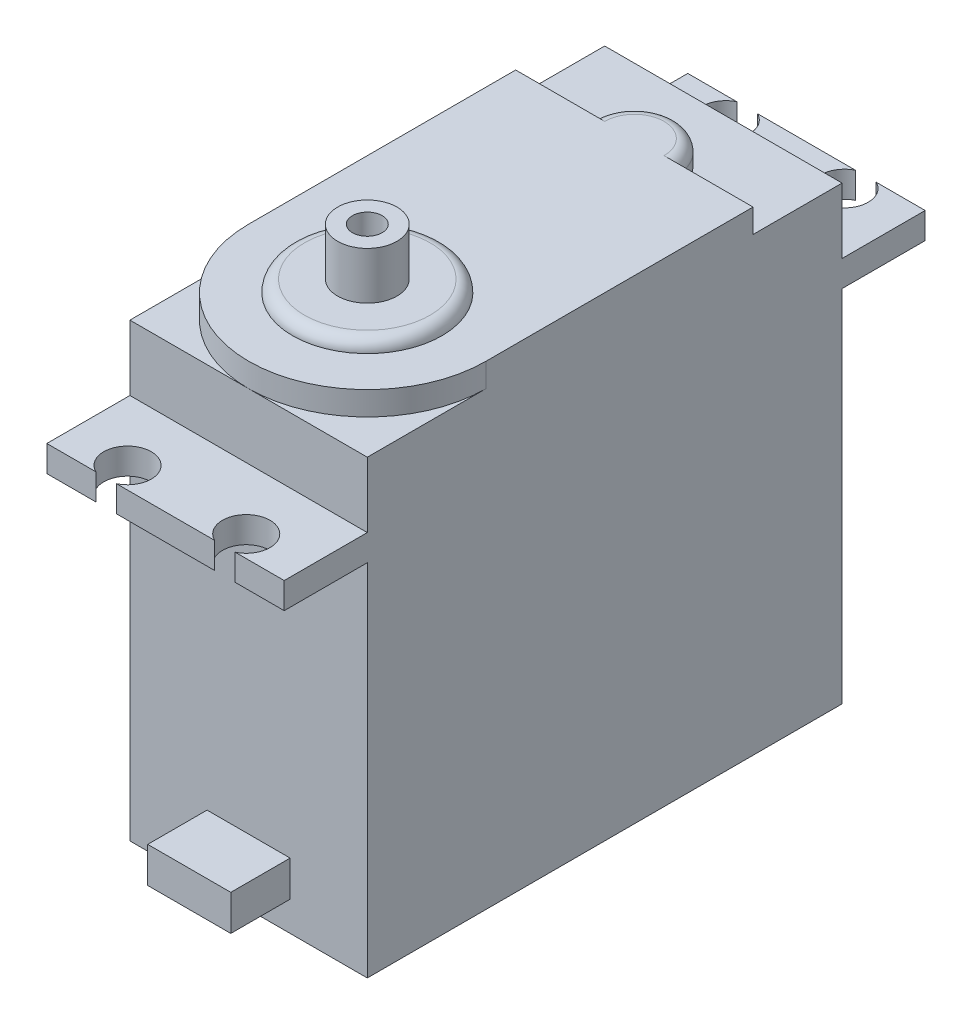
from build123d import *

# Parameters (mm, degrees)
SKETCH1_W                = 20
SKETCH1_H                = 40
BOSS_EXTRUDE1_DEPTH      = 38
SKETCH2_W                = 7
SKETCH2_H                = 3
BOSS_EXTRUDE2_DEPTH      = 5
SKETCH3_R                = 2.5
BOSS_EXTRUDE3_DEPTH      = 7
BOSS_EXTRUDE4_DEPTH      = 7
BOSS_EXTRUDE4_DEPTH_BACK = 47
SKETCH4_W                = 20
SKETCH4_H                = 2.2
SKETCH5_R                = 2
CUT_EXTRUDE1_DEPTH       = 7
BOSS_EXTRUDE5_DEPTH      = 2
SKETCH7_R                = 6.289454611
BOSS_EXTRUDE6_DEPTH      = 1
FILLET1_R                = 1
FILLET2_R                = 1
SKETCH8_R                = 1.25
CUT_EXTRUDE2_DEPTH       = 5


with BuildPart() as part:
    # Sketch1 → Boss-Extrude1 (new body)
    with BuildSketch(Plane(origin=(0, 0, 0), x_dir=(1, 0, 0), z_dir=(0, 1, 0))):
        with Locations((10, 20)):
            Rectangle(SKETCH1_W, SKETCH1_H)
    extrude(amount=BOSS_EXTRUDE1_DEPTH)

    # Sketch2 → Boss-Extrude2 (add)
    with BuildSketch(Plane.XY):
        with Locations((10, 4)):
            Rectangle(SKETCH2_W, SKETCH2_H)
    extrude(amount=BOSS_EXTRUDE2_DEPTH)

    # Sketch3 → Boss-Extrude3 (add)
    with BuildSketch(Plane(origin=(0, 38, 0), x_dir=(1, 0, 0), z_dir=(0, 1, 0))):
        with Locations(Location((10, 10, 0), (0, 0, 90))):
            Circle(SKETCH3_R)
    extrude(amount=BOSS_EXTRUDE3_DEPTH)

    # Sketch4 → Boss-Extrude4 (add, two sides: drawn at the far end of the back side and taken through both)
    with BuildSketch(Plane.XY.offset(-BOSS_EXTRUDE4_DEPTH_BACK)):
        with Locations((10, 31.4)):
            Rectangle(SKETCH4_W, SKETCH4_H)
    extrude(amount=BOSS_EXTRUDE4_DEPTH + BOSS_EXTRUDE4_DEPTH_BACK)

    # Sketch5 → Cut-Extrude1 (cut)
    with BuildSketch(Plane(origin=(0, 32.5, 0), x_dir=(1, 0, 0), z_dir=(0, 1, 0))):
        with Locations((15, 45.2)):
            Circle(SKETCH5_R)
        with Locations((5, 45.2)):
            Circle(SKETCH5_R)
        with Locations((15, -5.2)):
            Circle(SKETCH5_R)
        with Locations((5, -5.2)):
            Circle(SKETCH5_R)
    extrude(amount=-CUT_EXTRUDE1_DEPTH, mode=Mode.SUBTRACT)

    # Sketch6 → Boss-Extrude5 (add)
    with BuildSketch(Plane(origin=(0, 38, 0), x_dir=(1, 0, 0), z_dir=(0, 1, 0))):
        with BuildLine():
            Line((20, 32.5), (13.5, 32.5))
            ThreePointArc((13.5, 32.5), (10, 36), (6.5, 32.5))
            Line((6.5, 32.5), (0, 32.5))
            Line((0, 32.5), (0, 10))
            ThreePointArc((0, 10), (10, 0), (20, 10))
            Line((20, 10), (20, 32.5))
        make_face()
    extrude(amount=BOSS_EXTRUDE5_DEPTH)

    # Sketch7 → Boss-Extrude6 (add)
    with BuildSketch(Plane(origin=(0, 40, 0), x_dir=(1, 0, 0), z_dir=(0, 1, 0))):
        with Locations(Location((10, 10, 0), (0, 0, 270))):
            Circle(SKETCH7_R)
    extrude(amount=BOSS_EXTRUDE6_DEPTH)

    # Fillet1
    fillet1_edges = [part.edges().sort_by_distance(p)[0] for p in [
        (10, 41, -16.289454611),
    ]]
    fillet(fillet1_edges, radius=FILLET1_R - 0.0001)  # a hair under: the kernel refuses the full size

    # Fillet2
    fillet2_edges = [part.edges().sort_by_distance(p)[0] for p in [
        (10, 40, -36),
    ]]
    fillet(fillet2_edges, radius=FILLET2_R)

    # Sketch8 → Cut-Extrude2 (cut)
    with BuildSketch(Plane(origin=(0, 45, 0), x_dir=(1, 0, 0), z_dir=(0, 1, 0))):
        with Locations(Location((10, 10, 0), (0, 0, 270))):
            Circle(SKETCH8_R)
    extrude(amount=-CUT_EXTRUDE2_DEPTH, mode=Mode.SUBTRACT)


solid = part.part
